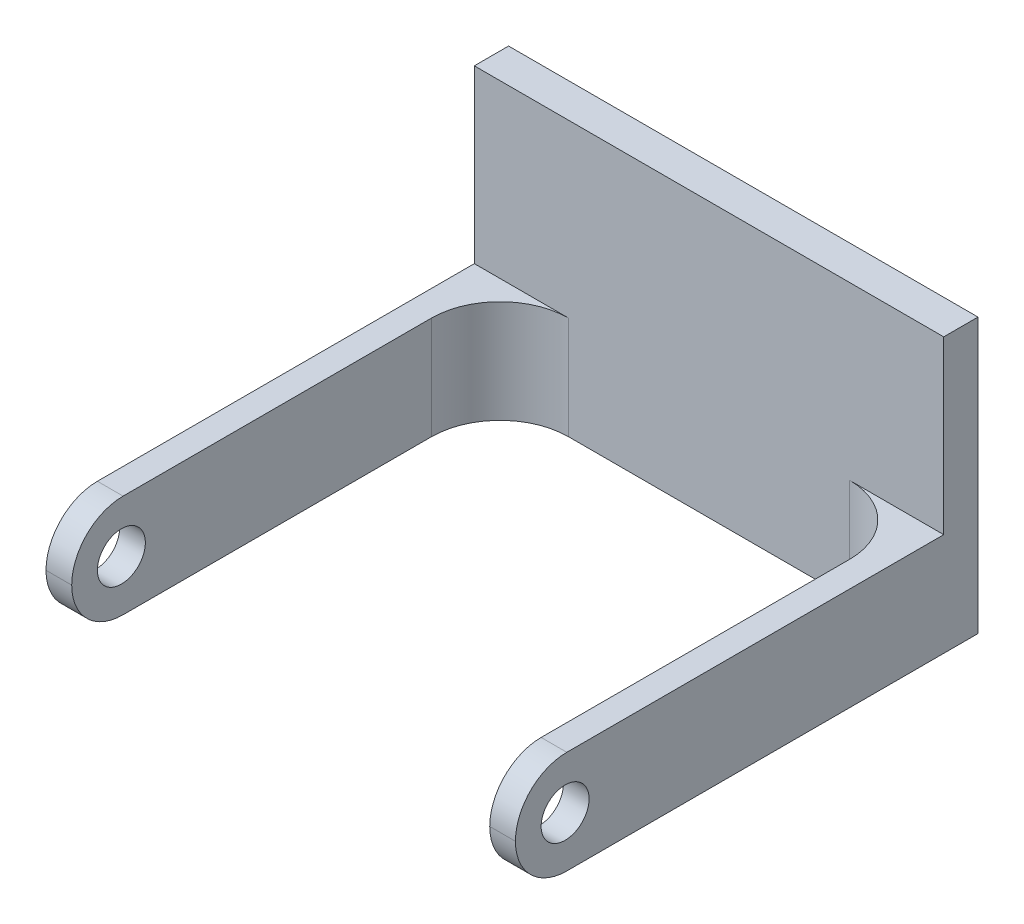
from build123d import *

# Parameters (mm, degrees)
SKETCH1_W           = 27.4
SKETCH1_H           = 6
BOSS_EXTRUDE1_DEPTH = 2
SKETCH2_W           = 1.5
SKETCH2_H           = 6
BOSS_EXTRUDE2_DEPTH = 25
SKETCH3_R           = 1.4
CUT_EXTRUDE1_DEPTH  = 39.584452828
FILLET1_R           = 3
SKETCH4_W           = 27.4
SKETCH4_H           = 2
BOSS_EXTRUDE3_DEPTH = 10
FILLET2_R           = 4


with BuildPart() as part:
    # Sketch1 → Boss-Extrude1 (new body)
    with BuildSketch(Plane.XY):
        Rectangle(SKETCH1_W, SKETCH1_H)
    extrude(amount=BOSS_EXTRUDE1_DEPTH)

    # Sketch2 → Boss-Extrude2 (add)
    with BuildSketch(Plane.XY.offset(2)):
        with Locations((-12.95, 0)):
            Rectangle(SKETCH2_W, SKETCH2_H)
        with Locations((12.95, 0)):
            Rectangle(SKETCH2_W, SKETCH2_H)
    extrude(amount=BOSS_EXTRUDE2_DEPTH)

    # Sketch3 → Cut-Extrude1 (cut, through all)
    with BuildSketch(Plane(origin=(13.7, 0, 0), x_dir=(0, 0, -1), z_dir=(1, 0, 0))):
        with Locations((-24.1, 0)):
            Circle(SKETCH3_R)
    extrude(amount=-CUT_EXTRUDE1_DEPTH, mode=Mode.SUBTRACT)

    # Fillet1
    fillet1_edges = [part.edges().sort_by_distance(p)[0] for p in [
        (-12.95, -3, 27),
        (12.95, -3, 27),
        (-12.95, 3, 27),
        (12.95, 3, 27),
    ]]
    fillet(fillet1_edges, radius=FILLET1_R - 0.0001)  # a hair under: the kernel refuses the full size

    # Sketch4 → Boss-Extrude3 (add)
    with BuildSketch(Plane(origin=(0, 3, 0), x_dir=(1, 0, 0), z_dir=(0, 1, 0))):
        with Locations((0, -1)):
            Rectangle(SKETCH4_W, SKETCH4_H)
    extrude(amount=BOSS_EXTRUDE3_DEPTH)

    # Fillet2
    fillet2_edges = [part.edges().sort_by_distance(p)[0] for p in [
        (12.2, 0, 2),
        (-12.2, 0, 2),
    ]]
    fillet(fillet2_edges, radius=FILLET2_R)


solid = part.part
